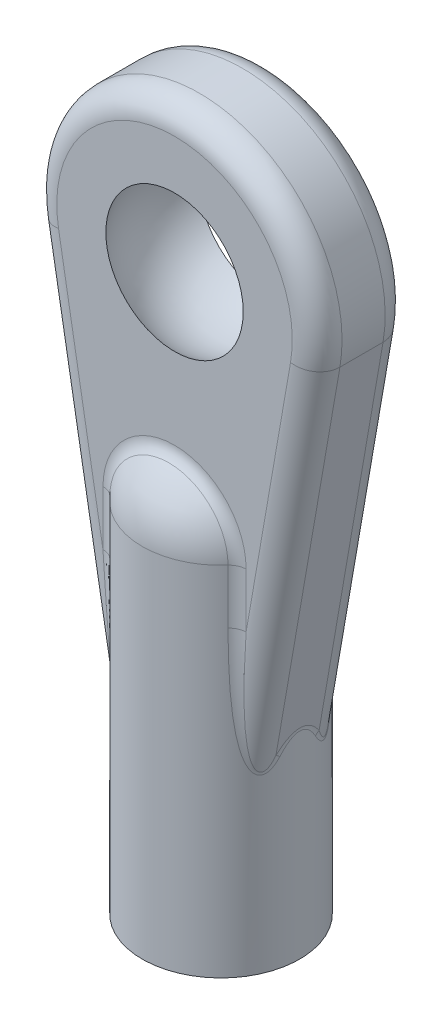
from build123d import *

# Parameters (mm, degrees)
BOSS_EXTRUDE1_DEPTH   = 1.4
FILLET1_R             = 0.75
FILLET2_R             = 0.5
M3_TAPPED_HOLE1_D     = 2.5
M3_TAPPED_HOLE1_DEPTH = 8.636
M3_TAPPED_HOLE1_TIP   = 0.7510757737844503


with BuildPart() as part:
    # Sketch1 → Boss-Extrude1 (new, symmetric)
    with BuildSketch(Plane.XY):
        with BuildLine():
            Line((2.375000000000002, -11.45), (4.23652800296372, -0.7360913530970443))
            ThreePointArc((4.23652800296372, -0.7360913530970443), (2.6e-16, 4.3), (-4.236528002963721, -0.7360913530970459))
            Line((-4.236528002963721, -0.7360913530970459), (-2.3749999999999982, -11.45))
            Line((-2.3749999999999982, -11.45), (-2.201251271658748, -12.45))
            Line((-2.201251271658748, -12.45), (2.2012512716587507, -12.45))
            Line((2.2012512716587507, -12.45), (2.375000000000002, -11.45))
        make_face()
    extrude(amount=BOSS_EXTRUDE1_DEPTH, both=True)

    # Sketch2 → Revolve1 (revolve)
    with BuildSketch(Plane.XY):
        with BuildLine():
            Line((2.14e-15, -17.45), (-2.3749999999999982, -17.45))
            Line((-2.3749999999999982, -17.45), (-2.3749999999999982, -11.45))
            Line((-2.3749999999999982, -11.45), (-2.3749999999999982, -6.674999999999999))
            ThreePointArc((-2.3749999999999982, -6.674999999999999), (-1.6793786053180495, -4.995621394681949), (5.2e-16, -4.3))
            Line((5.2e-16, -4.3), (0, -6.674999999999999))
            Line((0, -6.674999999999999), (2.14e-15, -17.45))
        make_face()
    revolve(axis=Axis((0, 0, 0), (1.2e-16, -1, 0)))

    # Sketch3 → Cut-Revolve1 (revolve, cut)
    with BuildSketch(Plane(origin=(0, 0, 0), x_dir=(0, 0, -1), z_dir=(1, 0, 0))):
        with BuildLine():
            Line((0, -2.5), (0, 2.5))
            ThreePointArc((0, 2.5), (-2.5, 3.1e-16), (0, -2.5))
        make_face()
    revolve(axis=Axis((0, -2.5, 0), (0, 1, 0)), mode=Mode.SUBTRACT)

    # Fillet1
    fillet1_edges = [part.edges().sort_by_distance(p)[0] for p in [
        (3.2188896373112352, -6.593045676548522, -1.4),
        (-1.33e-15, 4.3, -1.4),
        (3.2188896373112352, -6.593045676548521, 1.4),
        (-1.33e-15, 4.3, 1.4),
        (-3.218889637311235, -6.593045676548522, -1.4),
        (-3.218889637311235, -6.593045676548522, 1.4),
    ]]
    fillet(fillet1_edges, radius=FILLET1_R)

    # Fillet2
    fillet2_edges = [part.edges().sort_by_distance(p)[0] for p in [
        (1.9665540785377476, -11.246904736307442, -1.3316493760984214),
        (1.9184955042949687, -8.185566780342553, -1.4),
        (1.8e-16, -4.756504495705033, -1.4),
        (-1.966554078537744, -11.24690473630743, -1.3316493760984225),
        (1.9665540785377458, -11.246904736307426, 1.331649376098422),
        (1.9184955042949687, -8.185566780342551, 1.4),
        (1.8e-16, -4.756504495705033, 1.4),
        (-1.9665540785377433, -11.246904736307432, 1.3316493760984227),
        (-1.9184955042949665, -8.185566780342551, -1.4),
        (-1.9184955042949665, -8.185566780342553, 1.4),
        (2.3749999999999987, -11.45000000000002, 1.2778317346e-07),
        (-2.3435903182191735, -11.630776470024774, 0.3849797661557629),
    ]]
    fillet(fillet2_edges, radius=FILLET2_R)

    # M3 Tapped Hole1
    with Locations(Plane(origin=(2.14e-15, -17.45, 0), x_dir=(-1, -1.2e-16, 0), z_dir=(1.2e-16, -1, 0))):
        with Locations((0, 0)):
            Hole(M3_TAPPED_HOLE1_D / 2, depth=M3_TAPPED_HOLE1_DEPTH)
            with Locations((0, 0, -(M3_TAPPED_HOLE1_DEPTH + M3_TAPPED_HOLE1_TIP / 2))):  # 118° drill point
                Cone(0, M3_TAPPED_HOLE1_D / 2, M3_TAPPED_HOLE1_TIP, mode=Mode.SUBTRACT)


solid = part.part
